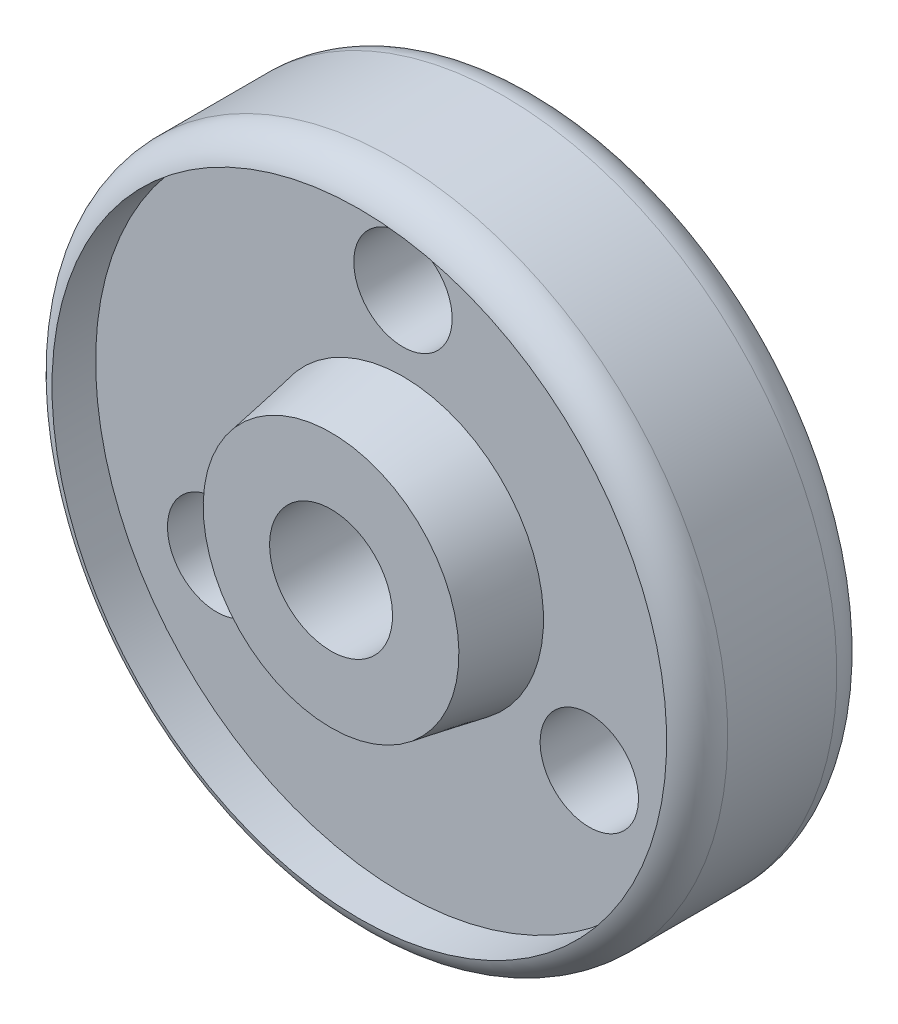
from build123d import *

# Parameters (mm, degrees)
SKETCH2_R          = 10.16
CUT_EXTRUDE2_DEPTH = 254
CIRPATTERN1_COUNT  = 3
FILLET1_R          = 7.62


with BuildPart() as part:
    # Sketch1 → Revolve1 (revolve)
    with BuildSketch(Plane(origin=(0, 0, 0), x_dir=(0, 0, -1), z_dir=(1, 0, 0)), mode=Mode.PRIVATE) as revolve1_sk:
        Polygon((-24.384, 12.7), (-24.384, 26.416), (-9.525, 29.036042606), (-9.525, 63.5), (-18.542, 63.5), (-18.542, 68.834), (18.542, 68.834), (18.542, 63.5), (9.525, 63.5), (9.525, 29.036042606), (24.384, 26.416), (24.384, 12.7), align=None)
    revolve(revolve1_sk.sketch.rotate(Axis((0, 0, 0), (0, 0, -1)), 180), axis=Axis((0, 0, 0), (0, 0, -1)))

    # Sketch2 → Cut-Extrude2 (cut, symmetric)
    with BuildSketch(Plane.XY):
        with Locations(Location((0, 44.45, 0), (0, 0, 90))):
            Circle(SKETCH2_R)
    cut_extrude2 = extrude(amount=CUT_EXTRUDE2_DEPTH, both=True, mode=Mode.SUBTRACT)

    # CirPattern1: Cut-Extrude2 ×3 about axis
    cirpattern1_axis = Axis((0, 0, 0), (0, 0, 1))
    for i in range(1, CIRPATTERN1_COUNT):
        add(cut_extrude2.rotate(cirpattern1_axis, i * 360 / CIRPATTERN1_COUNT), mode=Mode.SUBTRACT)

    # Fillet1
    # the kernel refuses this fillet: 7.62 mm, written as the material it takes off along each edge
    with BuildSketch(Plane(origin=(0, 0, 18.542), x_dir=(0, -1, 0), z_dir=(1, 0, 0))) as fillet1_piece_1:
        with BuildLine():
            CenterArc((61.214, 7.269016715), FILLET1_R, 287.457603124, 72.542396876)
            Line((68.834, 7.269016715), (68.9864, 7.269016715))
            Line((68.9864, 7.269016715), (68.9864, 0))
            Line((68.9864, 0), (68.834, -0.1524))
            ThreePointArc((68.834, -0.1524), (66.167, -0.1524), (63.54572, -0.145380334))
            Line((63.54572, -0.145380334), (63.5, 0))
        make_face()
    revolve(axis=Axis((0, 0, 18.542), (0, 0, -1)), mode=Mode.SUBTRACT)
    with BuildSketch(Plane(origin=(0, 0, -18.542), x_dir=(0, -1, 0), z_dir=(1, 0, 0))) as fillet1_piece_2:
        with BuildLine():
            CenterArc((61.214, -7.269016715), FILLET1_R, 0, 72.542396876)
            Line((63.5, 0), (63.54572, 0.145380334))
            ThreePointArc((63.54572, 0.145380334), (66.167, 0.1524), (68.834, 0.1524))
            Line((68.834, 0.1524), (68.9864, 0))
            Line((68.9864, 0), (68.9864, -7.269016715))
            Line((68.9864, -7.269016715), (68.834, -7.269016715))
        make_face()
    revolve(axis=Axis((0, 0, -18.542), (0, 0, -1)), mode=Mode.SUBTRACT)


solid = part.part
